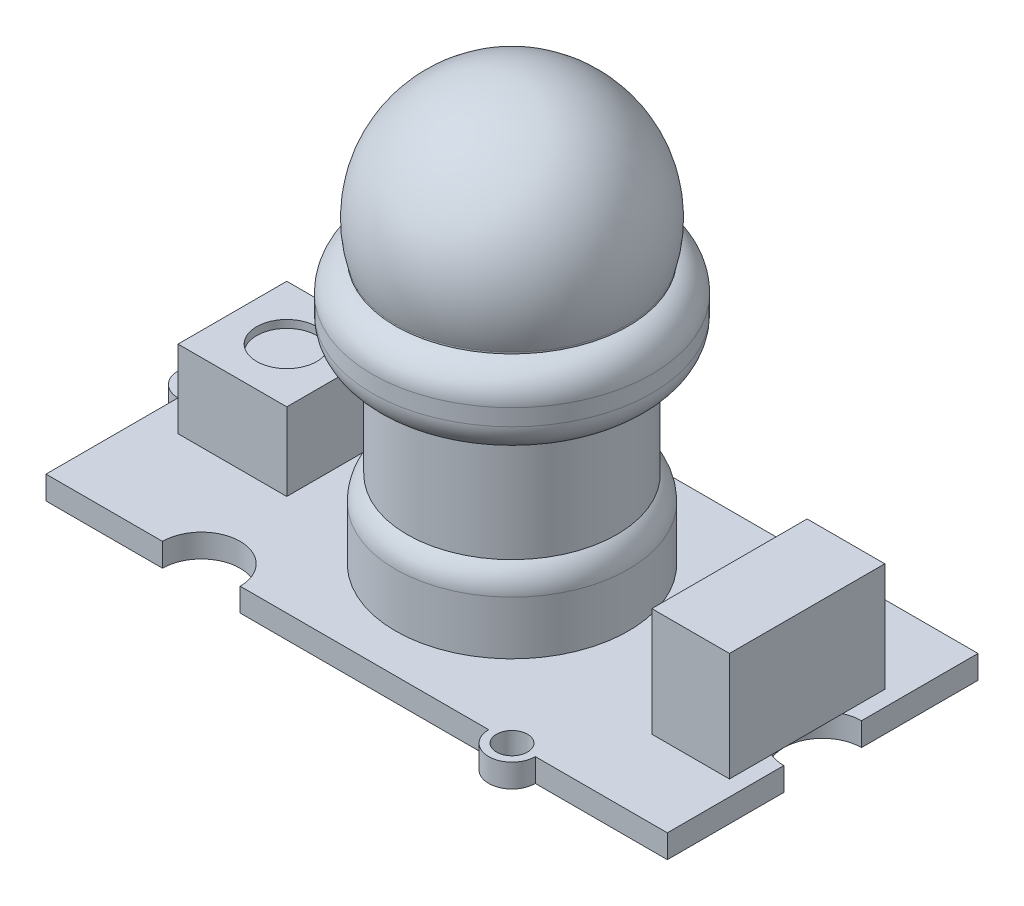
from build123d import *

# Parameters (mm, degrees)
SKETCH1_W           = 40
SKETCH1_H           = 20
BOSS_EXTRUDE1_DEPTH = 1.5
SKETCH2_R           = 1.5
BOSS_EXTRUDE2_DEPTH = 1.5
SKETCH3_R           = 1
SKETCH3_R_2         = 2.5
CUT_EXTRUDE1_DEPTH  = 1.5
SKETCH4_W           = 7
SKETCH4_H           = 7
BOSS_EXTRUDE3_DEPTH = 5
SKETCH5_R           = 1.940753899
CUT_EXTRUDE2_DEPTH  = 0.5
SKETCH6_W           = 5
SKETCH6_H           = 10
BOSS_EXTRUDE4_DEPTH = 7
SKETCH7_R           = 7.5
BOSS_EXTRUDE5_DEPTH = 5
SKETCH8_R           = 6.75
BOSS_EXTRUDE6_DEPTH = 7
SKETCH9_R           = 9
BOSS_EXTRUDE7_DEPTH = 5
SKETCH11_R          = 7.5
BOSS_EXTRUDE8_DEPTH = 0.1
DOME1_FACE_RADIUS   = 7.5
DOME1_HEIGHT        = 10
FILLET2_R           = 2
FILLET4_R           = 2


with BuildPart() as part:
    # Sketch1 → Boss-Extrude1 (new body)
    with BuildSketch(Plane(origin=(0, 0, 0), x_dir=(1, 0, 0), z_dir=(0, 1, 0))):
        Rectangle(SKETCH1_W, SKETCH1_H)
    extrude(amount=BOSS_EXTRUDE1_DEPTH)

    # Sketch2 → Boss-Extrude2 (add)
    with BuildSketch(Plane(origin=(0, 1.5, 0), x_dir=(1, 0, 0), z_dir=(0, 1, 0))):
        with Locations((-20, 0)):
            Circle(SKETCH2_R)
        with Locations((10, 10)):
            Circle(SKETCH2_R)
        with Locations((10, -10)):
            Circle(SKETCH2_R)
    extrude(amount=-BOSS_EXTRUDE2_DEPTH)

    # Sketch3 → Cut-Extrude1 (cut)
    with BuildSketch(Plane(origin=(0, 1.5, 0), x_dir=(1, 0, 0), z_dir=(0, 1, 0))):
        with Locations(Location((-20, 0, 0), (0, 0, 270))):
            Circle(SKETCH3_R)
        with Locations(Location((10, -10, 0), (0, 0, 270))):
            Circle(SKETCH3_R)
        with Locations(Location((10, 10, 0), (0, 0, 270))):
            Circle(SKETCH3_R)
        with Locations((-10, -10)):
            Circle(SKETCH3_R_2)
        with Locations((-10, 10)):
            Circle(SKETCH3_R_2)
        with Locations((20, 0)):
            Circle(SKETCH3_R_2)
    extrude(amount=-CUT_EXTRUDE1_DEPTH, mode=Mode.SUBTRACT)

    # Sketch4 → Boss-Extrude3 (add)
    with BuildSketch(Plane(origin=(0, 1.5, 0), x_dir=(1, 0, 0), z_dir=(0, 1, 0))):
        with Locations((-14.5, 0)):
            Rectangle(SKETCH4_W, SKETCH4_H)
    extrude(amount=BOSS_EXTRUDE3_DEPTH)

    # Sketch5 → Cut-Extrude2 (cut)
    with BuildSketch(Plane(origin=(0, 6.5, 0), x_dir=(1, 0, 0), z_dir=(0, 1, 0))):
        with Locations(Location((-14.5, 0, 0), (0, 0, 270))):
            Circle(SKETCH5_R)
    extrude(amount=-CUT_EXTRUDE2_DEPTH, mode=Mode.SUBTRACT)

    # Sketch6 → Boss-Extrude4 (add)
    with BuildSketch(Plane(origin=(0, 1.5, 0), x_dir=(1, 0, 0), z_dir=(0, 1, 0))):
        with Locations((16.5, 0)):
            Rectangle(SKETCH6_W, SKETCH6_H)
    extrude(amount=BOSS_EXTRUDE4_DEPTH)

    # Sketch7 → Boss-Extrude5 (add)
    with BuildSketch(Plane(origin=(0, 1.5, 0), x_dir=(1, 0, 0), z_dir=(0, 1, 0))):
        with Locations(Location((0, 0, 0), (0, 0, 270))):
            Circle(SKETCH7_R)
    extrude(amount=BOSS_EXTRUDE5_DEPTH)

    # Sketch8 → Boss-Extrude6 (add)
    with BuildSketch(Plane(origin=(0, 6.5, 0), x_dir=(1, 0, 0), z_dir=(0, 1, 0))):
        with Locations(Location((0, 0, 0), (0, 0, 270))):
            Circle(SKETCH8_R)
    extrude(amount=BOSS_EXTRUDE6_DEPTH)

    # Sketch9 → Boss-Extrude7 (add)
    with BuildSketch(Plane(origin=(0, 13.5, 0), x_dir=(1, 0, 0), z_dir=(0, 1, 0))):
        with Locations(Location((0, 0, 0), (0, 0, 270))):
            Circle(SKETCH9_R)
    extrude(amount=BOSS_EXTRUDE7_DEPTH)

    # Sketch11 → Boss-Extrude8 (add)
    with BuildSketch(Plane(origin=(0, 18.5, 0), x_dir=(1, 0, 0), z_dir=(0, 1, 0))):
        with Locations(Location((0, 0, 0), (0, 0, 270))):
            Circle(SKETCH11_R)
    extrude(amount=BOSS_EXTRUDE8_DEPTH)

    # Dome1: a dome of height H over a round flat face of radius A is a cap of a sphere of radius (A * A + H * H) / (2 * H)
    dome1_r = (DOME1_FACE_RADIUS * DOME1_FACE_RADIUS + DOME1_HEIGHT * DOME1_HEIGHT) / (2 * DOME1_HEIGHT)
    dome1_base = Plane((0, 18.6, 0), z_dir=(0, 1, 0))
    with Locations(dome1_base.offset(DOME1_HEIGHT - dome1_r)):
        dome1_ball = Sphere(dome1_r, mode=Mode.PRIVATE)
    add(split(dome1_ball, bisect_by=dome1_base, keep=Keep.TOP, mode=Mode.PRIVATE))

    # Fillet2
    # the kernel refuses this fillet: 2 mm, written as the material it takes off along each edge
    with BuildSketch(Plane(origin=(0, 13.5, 0), x_dir=(0, 0, 1), z_dir=(-1, 0, 0))) as fillet2_piece_1:
        with BuildLine():
            CenterArc((9 - FILLET2_R, FILLET2_R), FILLET2_R, 270, 90)
            Line((9 - FILLET2_R, 0), (9 - FILLET2_R, -FILLET2_R * 0.02))
            Line((9 - FILLET2_R, -FILLET2_R * 0.02), (9 + FILLET2_R * 0.02, -FILLET2_R * 0.02))
            Line((9 + FILLET2_R * 0.02, -FILLET2_R * 0.02), (9 + FILLET2_R * 0.02, FILLET2_R))
            Line((9 + FILLET2_R * 0.02, FILLET2_R), (9, FILLET2_R))
        make_face()
    revolve(axis=Axis((0, 13.5, 0), (0, 1, 0)), mode=Mode.SUBTRACT)
    with BuildSketch(Plane(origin=(0, 18.5, 0), x_dir=(0, 0, 1), z_dir=(-1, 0, 0))) as fillet2_piece_2:
        with BuildLine():
            CenterArc((7, -1.936491673), FILLET2_R, 0, 75.522487814)
            Line((7.5, 0), (7.51, 0.038729833))
            ThreePointArc((7.51, 0.038729833), (8.25, 0.04), (9, 0.04))
            Line((9, 0.04), (9.04, 0))
            Line((9.04, 0), (9.04, -1.936491673))
            Line((9.04, -1.936491673), (9, -1.936491673))
        make_face()
    revolve(axis=Axis((0, 18.5, 0), (0, 1, 0)), mode=Mode.SUBTRACT)

    # Fillet4
    # the kernel refuses this fillet: 2 mm, written as the material it takes off along each edge
    with BuildSketch(Plane(origin=(0, 6.5, 0), x_dir=(0, 0, 1), z_dir=(-1, 0, 0))) as fillet4_piece_1:
        with BuildLine():
            CenterArc((5.5, -1.5612495), FILLET4_R, 0, 51.317812547)
            Line((7.5, -1.5612495), (7.54, -1.5612495))
            Line((7.54, -1.5612495), (7.54, 0))
            Line((7.54, 0), (7.5, 0.04))
            ThreePointArc((7.5, 0.04), (7.125, 0.04), (6.775, 0.03122499))
            Line((6.775, 0.03122499), (6.75, 0))
        make_face()
    revolve(axis=Axis((0, 6.5, 0), (0, 1, 0)), mode=Mode.SUBTRACT)


solid = part.part
